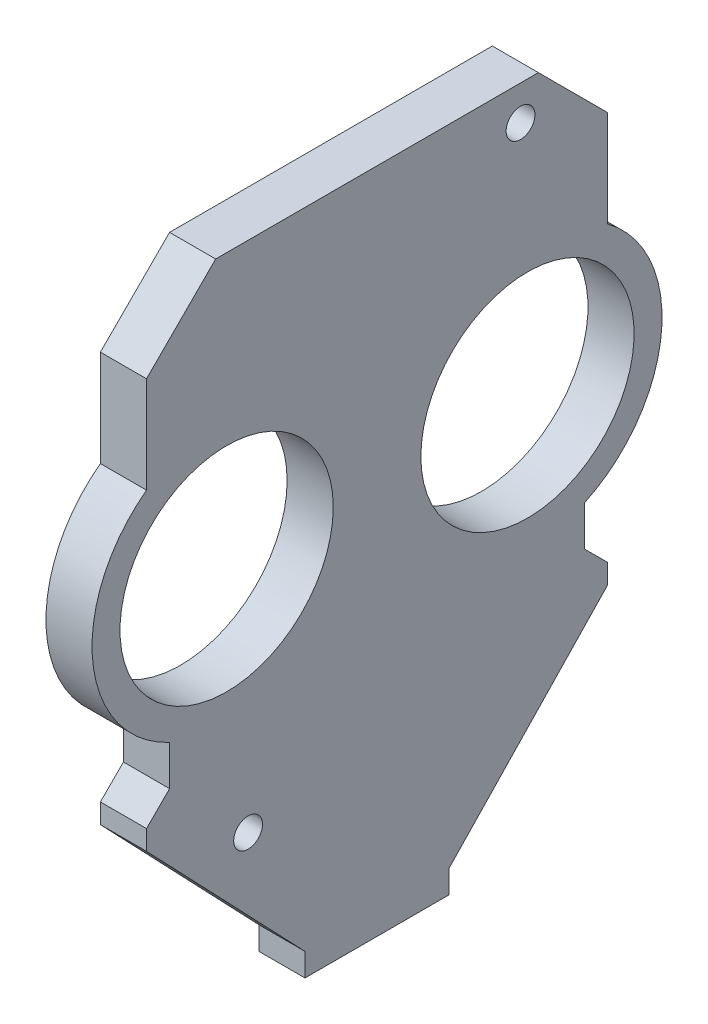
from build123d import *

# Parameters (mm, degrees)
SKETCH1_R           = 2.5
SKETCH1_R_2         = 18.5
BOSS_EXTRUDE1_DEPTH = 8


with BuildPart() as part:
    # Sketch1 → Boss-Extrude1 (new body)
    with BuildSketch(Plane(origin=(0, 0, 0), x_dir=(0, 0, -1), z_dir=(1, 0, 0))):
        with BuildLine():
            Line((-12.5, -64.29), (-40, -35.5))
            Line((-40, -35.5), (-40, -32.085523479))
            Line((-40, -32.085523479), (-36, -28.085523479))
            Line((-36, -28.085523479), (-36, -21.143055078))
            ThreePointArc((-36, -21.143055078), (-49.329627244, -2.32877567), (-40, 18.757099403))
            Line((-40, 18.757099403), (-40, 35.5))
            Line((-40, 35.5), (-28, 47.5))
            Line((-28, 47.5), (28, 47.5))
            Line((28, 47.5), (40, 35.5))
            Line((40, 35.5), (40, 18.757099403))
            ThreePointArc((40, 18.757099403), (49.329627244, -2.32877567), (36, -21.143055078))
            Line((36, -21.143055078), (36, -28.085523479))
            Line((36, -28.085523479), (40, -32.085523479))
            Line((40, -32.085523479), (40, -35.5))
            Line((40, -35.5), (12.5, -64.29))
            Line((12.5, -64.29), (12.5, -68.29))
            Line((12.5, -68.29), (-12.5, -68.29))
            Line((-12.5, -68.29), (-12.5, -64.29))
        make_face()
        with Locations((-22.373880505, -41.5)):
            Circle(SKETCH1_R, mode=Mode.SUBTRACT)
        with Locations((24.891578032, 41.5)):
            Circle(SKETCH1_R, mode=Mode.SUBTRACT)
        with Locations((-26.1, 0)):
            Circle(SKETCH1_R_2, mode=Mode.SUBTRACT)
        with Locations((26.1, 0)):
            Circle(SKETCH1_R_2, mode=Mode.SUBTRACT)
    extrude(amount=BOSS_EXTRUDE1_DEPTH)


solid = part.part
